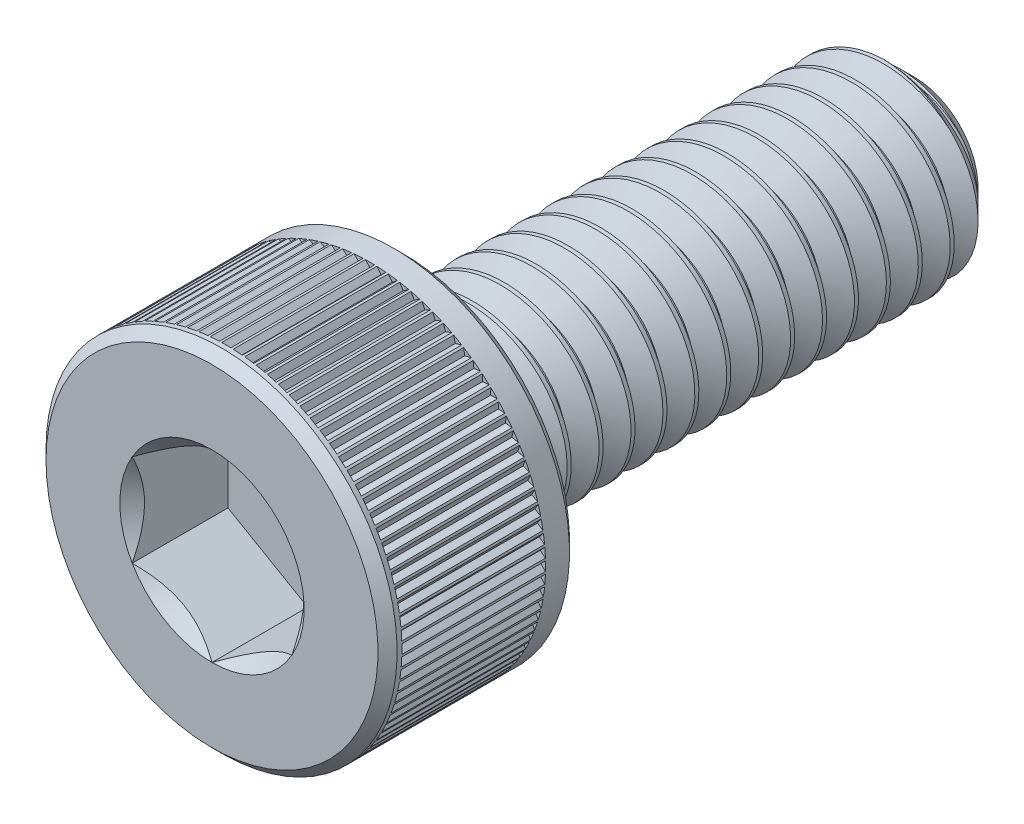
from build123d import *

# Parameters (mm, degrees)
CUT_EXTRUDE1_START = -1.5
CUT_EXTRUDE1_DEPTH = 1.5
SKETCH4_R          = 1.443375673
CUT_EXTRUDE2_DEPTH = 0.5
CUT_EXTRUDE2_DRAFT = -45
CUT_SWEEP1_PITCH   = 0.5
CUT_SWEEP1_TO      = 8
CUT_EXTRUDE4_START = -0.975
CUT_EXTRUDE4_DEPTH = 2.25
CIRPATTERN2_COUNT  = 96


with BuildPart() as part:
    # Sketch2 → Revolve1 (revolve)
    with BuildSketch(Plane(origin=(0, 0, 0), x_dir=(0, 0, -1), z_dir=(1, 0, 0)), mode=Mode.PRIVATE) as revolve1_sk:
        Polygon((-5.35, 2.75), (-2.65, 2.75), (-2.5, 2.6), (-2.5, 1.5), (5, 1.5), (5.5, 1), (5.5, 0), (-5.5, 0), (-5.5, 2.6), align=None)
    revolve(revolve1_sk.sketch.rotate(Axis((0, 0, -5.5), (0, 0, 1)), 90), axis=Axis((0, 0, -5.5), (0, 0, 1)))

    # Sketch3 → Cut-Extrude1 (cut)
    with BuildSketch(Plane.XY.offset(5.5).offset(CUT_EXTRUDE1_START)):
        Polygon((0, 1.443375673), (-1.25, 0.721687836), (-1.25, -0.721687836), (0, -1.443375673), (1.25, -0.721687836), (1.25, 0.721687836), align=None)
    extrude(amount=CUT_EXTRUDE1_DEPTH, mode=Mode.SUBTRACT)


with BuildPart() as cut_extrude2_tool:
    # Sketch4 → Cut-Extrude2 (with draft: the straight prism first)
    with BuildSketch(Plane.XY.offset(5.5)):
        Circle(SKETCH4_R)
    extrude(amount=-CUT_EXTRUDE2_DEPTH)
    # Cut-Extrude2: the draft: its side faces are tilted about the plane it starts from
    cut_extrude2_sides = [cut_extrude2_tool.faces().sort_by_distance(p)[0] for p in [
        (-1.443375673, 0, 5.25),
    ]]
    draft(cut_extrude2_sides, Plane.XY.offset(5.5), CUT_EXTRUDE2_DRAFT)


with BuildPart() as part_1:
    add(part.part)

    # Cut-Extrude2: cut by cut_extrude2_tool
    add(cut_extrude2_tool.part, mode=Mode.SUBTRACT)


with BuildPart() as body_2:
    # Split1: read off the stored shape, not the designer's step
    # Split1: the piece on the far side of the plane
    add(part_1.part)
    split(bisect_by=Plane.XY.offset(2.5), keep=Keep.BOTTOM)

    # Cut-Sweep1: arcs per turn and ends read off the stored shape
    # Cut-Sweep1: the profile of Sketch7 screwed along a right-hand helix through 17 turns, 6 arcs to a turn; built about Z, then put on its axis
    cut_sweep1_z = Axis((0, 0, 0), (0, 0, 1))
    cut_sweep1_corners = [(1.527063294, 0, 0.015625), (1.527063294, 0, -0.453125), (1.175240474, 0, -0.25), (1.175240474, 0, -0.1875)]
    with BuildLine(mode=Mode.PRIVATE) as cut_sweep1_profile:
        Line(cut_sweep1_corners[0], cut_sweep1_corners[1])
        Line(cut_sweep1_corners[1], cut_sweep1_corners[2])
        Line(cut_sweep1_corners[2], cut_sweep1_corners[3])
        Line(cut_sweep1_corners[3], cut_sweep1_corners[0])
    cut_sweep1_cap = Face(cut_sweep1_profile.wire())
    cut_sweep1_turn_angles = [0, 30, 60, 90, 120, 150, 180, 210, 240, 270, 300, 330, 360]
    cut_sweep1_turn_weights = [1, 0.8660254037844387, 1, 0.8660254037844387, 1, 0.8660254037844387, 1, 0.8660254037844387, 1, 0.8660254037844387, 1, 0.8660254037844387, 1]
    cut_sweep1_turn_rails = [Edge.make_bspline([Vector(p[0], p[1], 0).rotate(cut_sweep1_z, cut_sweep1_turn_angles[k]) / cut_sweep1_turn_weights[k] + Vector(0, 0, p[2] + CUT_SWEEP1_PITCH * cut_sweep1_turn_angles[k] / 360) for k in range(13)], [0, 0, 0, 1, 1, 2, 2, 3, 3, 4, 4, 5, 5, 6, 6, 6], 2, cut_sweep1_turn_weights) for p in cut_sweep1_corners]
    cut_sweep1_turn_sides = [Face.make_surface_from_curves(cut_sweep1_turn_rails[p[0]], cut_sweep1_turn_rails[p[1]]) for p in [(0, 1), (1, 2), (2, 3), (3, 0)]]
    cut_sweep1 = Plane(origin=(0, 0, -5.5), x_dir=(0, 1, 0), z_dir=(0, 0, 1)) * split(Solid(Shell([*[p.moved(Location((0, 0, CUT_SWEEP1_PITCH * i))) for i in range(17) for p in cut_sweep1_turn_sides], cut_sweep1_cap, cut_sweep1_cap.rotate(cut_sweep1_z, 6120).moved(Location((0, 0, CUT_SWEEP1_PITCH * 6120 / 360)))])), bisect_by=Plane.XY.offset(CUT_SWEEP1_TO), keep=Keep.BOTTOM, mode=Mode.PRIVATE)
    add(cut_sweep1, mode=Mode.SUBTRACT)


with BuildPart() as part_2:
    add(part_1.part)

    # Split1
    split(bisect_by=Plane.XY.offset(2.5), keep=Keep.TOP)

    add(body_2.part)  # Boss-Extrude1 merges body 2
    # Boss-Extrude1: read off the stored shape, not the designer's step
    # Boss-Extrude1 outline → Boss-Extrude1 (revolve)
    with BuildSketch(Plane.XZ):
        Polygon((1.175238158, 2.5), (1.175238158, 2.175238158), (1.5, 2.5), align=None)
    revolve(axis=Axis((0, 0, 0), (0, 0, 1)))

    # Sketch9 → Cut-Extrude4 (cut)
    with BuildSketch(Plane.XY.offset(4).offset(CUT_EXTRUDE4_START)):
        with BuildLine():
            Line((0, 2.674375), (0.071986608, 2.749057644))
            ThreePointArc((0.071986608, 2.749057644), (0, 2.75), (-0.071986608, 2.749057644))
            Line((-0.071986608, 2.749057644), (0, 2.674375))
        make_face()
    cut_extrude4 = extrude(amount=CUT_EXTRUDE4_DEPTH, mode=Mode.SUBTRACT)

    # CirPattern2: Cut-Extrude4 ×96 about axis
    cirpattern2_axis = Axis((0, 0, 0), (0, 0, 1))
    for i in range(1, CIRPATTERN2_COUNT):
        add(cut_extrude4.rotate(cirpattern2_axis, i * 360 / CIRPATTERN2_COUNT), mode=Mode.SUBTRACT)


solid = part_2.part
